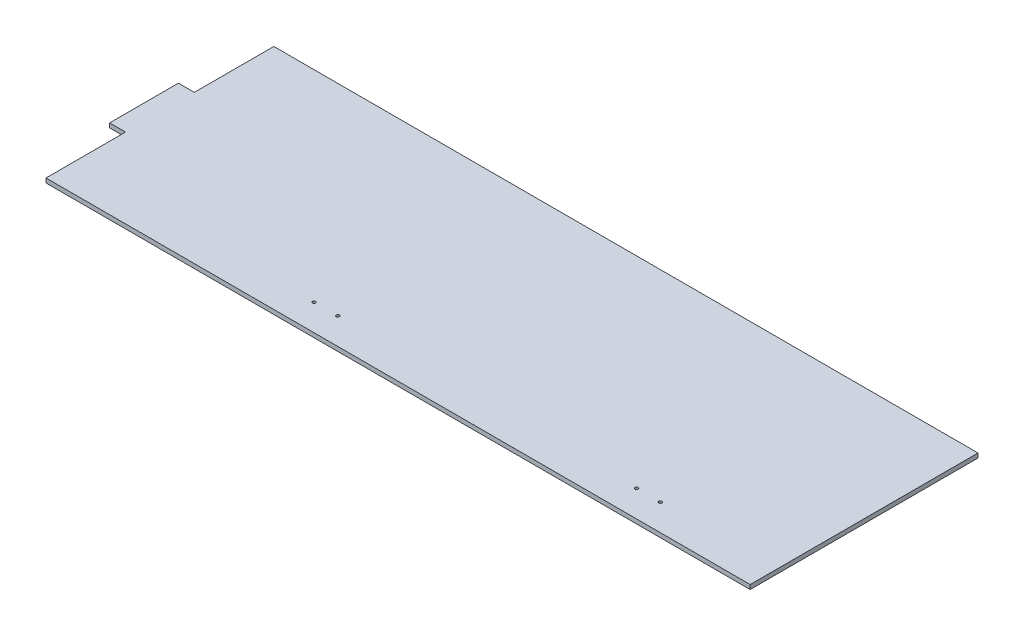
from build123d import *

# Parameters (mm, degrees)
BOSS_EXTRUDE1_START = 2
SKETCH1_R           = 1
BOSS_EXTRUDE1_DEPTH = 2.7432


with BuildPart() as part:
    # Sketch1 → Boss-Extrude1 (new body)
    with BuildSketch(Plane(origin=(0, 0, 0), x_dir=(1, 0, 0), z_dir=(0, 1, 0)).offset(BOSS_EXTRUDE1_START)):
        Polygon((-270, 21.625660705), (-280, 21.625660705), (-280, -21.625660705), (-270, -21.625660705), (-270, -71.625660705), (172.78, -71.625660705), (172.78, 71.625660705), (-270, 71.625660705), align=None)
        with Locations((-118.128664274, -54.974008218)):
            Circle(SKETCH1_R, mode=Mode.SUBTRACT)
        with Locations((-103.128664274, -54.974008218)):
            Circle(SKETCH1_R, mode=Mode.SUBTRACT)
        with Locations((84.671335726, -54.974008218)):
            Circle(SKETCH1_R, mode=Mode.SUBTRACT)
        with Locations((99.671335726, -54.974008218)):
            Circle(SKETCH1_R, mode=Mode.SUBTRACT)
    extrude(amount=BOSS_EXTRUDE1_DEPTH)


solid = part.part
